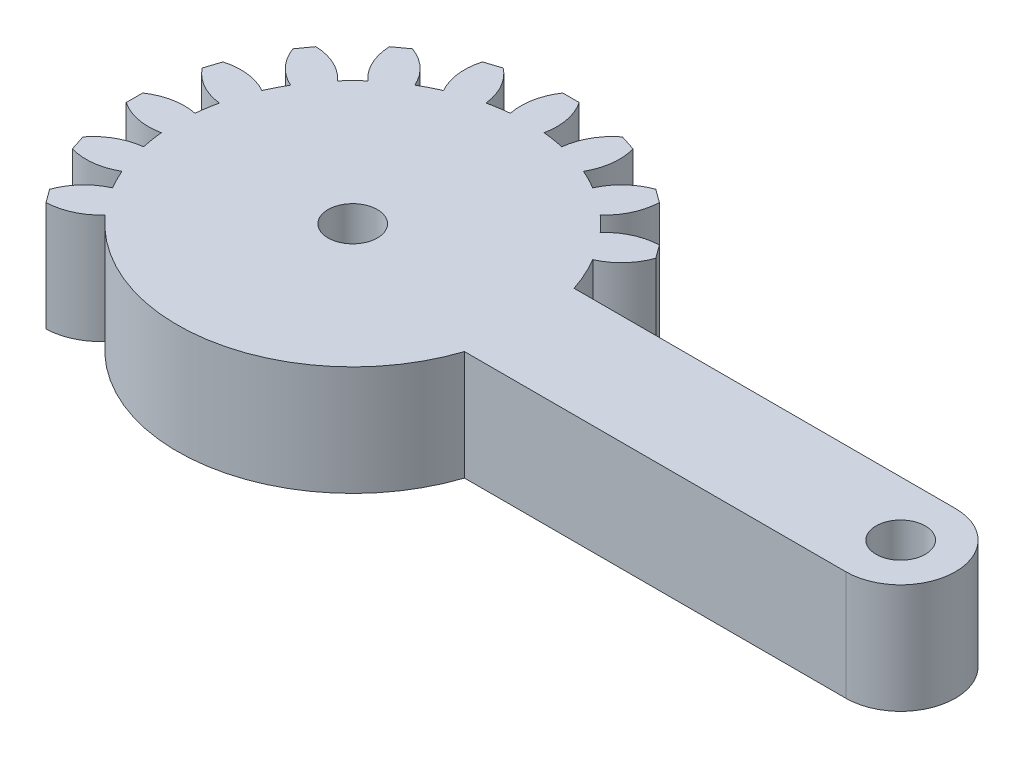
from build123d import *

# Parameters (mm, degrees)
SKETCH2_R           = 2.25
SKETCH2_R_2         = 16
BOSS_EXTRUDE1_DEPTH = 10


with BuildPart() as part:
    # Sketch2 → Boss-Extrude1 (new body)
    # profile 1 of 16: a face of its own
    with BuildSketch(Plane(origin=(0, 0, 0), x_dir=(1, 0, 0), z_dir=(0, 1, 0))):
        with BuildLine():
            ThreePointArc((50, -5), (55, 0), (50, 5))
            Line((50, 5), (18.789301737, 5))
            ThreePointArc((18.789301737, 5), (17.339527679, 3.953928118), (15.621614749, 3.459068176))
            ThreePointArc((15.621614749, 3.459068176), (15.80301345, 2.502951441), (15.925949353, 1.537575108))
            ThreePointArc((15.925949353, 1.537575108), (18.0017152, 1.549169767), (19.917509023, 0.75))
            Line((19.917509023, 0.75), (19.917509023, -0.75))
            ThreePointArc((19.917509023, -0.75), (18.0017152, -1.549169767), (15.925949353, -1.537575108))
            ThreePointArc((15.925949353, -1.537575108), (15.80301345, -2.502951441), (15.621614749, -3.459068176))
            ThreePointArc((15.621614749, -3.459068176), (17.339527679, -3.953928118), (18.789301737, -5))
            Line((18.789301737, -5), (50, -5))
        make_face()
        with Locations((50, 0)):
            Circle(SKETCH2_R, mode=Mode.SUBTRACT)
    # profile 2 of 16: a face of its own
    with BuildSketch(Plane(origin=(0, 0, 0), x_dir=(1, 0, 0), z_dir=(0, 1, 0))):
        with BuildLine():
            ThreePointArc((11.980599705, 10.604962551), (12.94427191, 9.404564037), (13.788127651, 8.117113766))
            ThreePointArc((13.788127651, 8.117113766), (15.474272667, 9.327838042), (16.554442225, 11.10045532))
            Line((16.554442225, 11.10045532), (15.672764346, 12.313980812))
            ThreePointArc((15.672764346, 12.313980812), (13.653114382, 11.834447379), (11.980599705, 10.604962551))
        make_face()
    # profile 3 of 16: a face of its own
    with BuildSketch(Plane(origin=(0, 0, 0), x_dir=(1, 0, 0), z_dir=(0, 1, 0))):
        with BuildLine():
            ThreePointArc((8.117113766, 13.788127651), (9.404564037, 12.94427191), (10.604962551, 11.980599705))
            ThreePointArc((10.604962551, 11.980599705), (11.834447379, 13.653114382), (12.313980812, 15.672764346))
            Line((12.313980812, 15.672764346), (11.10045532, 16.554442225))
            ThreePointArc((11.10045532, 16.554442225), (9.327838042, 15.474272667), (8.117113766, 13.788127651))
        make_face()
    # profile 4 of 16: a face of its own
    with BuildSketch(Plane(origin=(0, 0, 0), x_dir=(1, 0, 0), z_dir=(0, 1, 0))):
        with BuildLine():
            ThreePointArc((3.459068176, 15.621614749), (4.94427191, 15.216904261), (6.383709827, 14.671341072))
            ThreePointArc((6.383709827, 14.671341072), (7.036183926, 16.64192876), (6.868141161, 18.710913999))
            Line((6.868141161, 18.710913999), (5.441556387, 19.174439491))
            ThreePointArc((5.441556387, 19.174439491), (4.089487923, 17.599368331), (3.459068176, 15.621614749))
        make_face()
    # profile 5 of 16: a face of its own
    with BuildSketch(Plane(origin=(0, 0, 0), x_dir=(1, 0, 0), z_dir=(0, 1, 0))):
        with BuildLine():
            ThreePointArc((-1.537575108, 15.925949353), (0, 16), (1.537575108, 15.925949353))
            ThreePointArc((1.537575108, 15.925949353), (1.549169767, 18.0017152), (0.75, 19.917509023))
            Line((0.75, 19.917509023), (-0.75, 19.917509023))
            ThreePointArc((-0.75, 19.917509023), (-1.549169767, 18.0017152), (-1.537575108, 15.925949353))
        make_face()
    # profile 6 of 16: a face of its own
    with BuildSketch(Plane(origin=(0, 0, 0), x_dir=(1, 0, 0), z_dir=(0, 1, 0))):
        with BuildLine():
            ThreePointArc((-6.383709827, 14.671341072), (-4.94427191, 15.216904261), (-3.459068176, 15.621614749))
            ThreePointArc((-3.459068176, 15.621614749), (-4.089487923, 17.599368331), (-5.441556387, 19.174439491))
            Line((-5.441556387, 19.174439491), (-6.868141161, 18.710913999))
            ThreePointArc((-6.868141161, 18.710913999), (-7.036183926, 16.64192876), (-6.383709827, 14.671341072))
        make_face()
    # profile 7 of 16: a face of its own
    with BuildSketch(Plane(origin=(0, 0, 0), x_dir=(1, 0, 0), z_dir=(0, 1, 0))):
        with BuildLine():
            ThreePointArc((-10.604962551, 11.980599705), (-9.404564037, 12.94427191), (-8.117113766, 13.788127651))
            ThreePointArc((-8.117113766, 13.788127651), (-9.327838042, 15.474272667), (-11.10045532, 16.554442225))
            Line((-11.10045532, 16.554442225), (-12.313980812, 15.672764346))
            ThreePointArc((-12.313980812, 15.672764346), (-11.834447379, 13.653114382), (-10.604962551, 11.980599705))
        make_face()
    # profile 8 of 16: a face of its own
    with BuildSketch(Plane(origin=(0, 0, 0), x_dir=(1, 0, 0), z_dir=(0, 1, 0))):
        with BuildLine():
            ThreePointArc((-13.788127651, 8.117113766), (-12.94427191, 9.404564037), (-11.980599705, 10.604962551))
            ThreePointArc((-11.980599705, 10.604962551), (-13.653114382, 11.834447379), (-15.672764346, 12.313980812))
            Line((-15.672764346, 12.313980812), (-16.554442225, 11.10045532))
            ThreePointArc((-16.554442225, 11.10045532), (-15.474272667, 9.327838042), (-13.788127651, 8.117113766))
        make_face()
    # profile 9 of 16: a face of its own
    with BuildSketch(Plane(origin=(0, 0, 0), x_dir=(1, 0, 0), z_dir=(0, 1, 0))):
        with BuildLine():
            ThreePointArc((-15.621614749, 3.459068176), (-15.216904261, 4.94427191), (-14.671341072, 6.383709827))
            ThreePointArc((-14.671341072, 6.383709827), (-16.64192876, 7.036183926), (-18.710913999, 6.868141161))
            Line((-18.710913999, 6.868141161), (-19.174439491, 5.441556387))
            ThreePointArc((-19.174439491, 5.441556387), (-17.599368331, 4.089487923), (-15.621614749, 3.459068176))
        make_face()
    # profile 10 of 16: a face of its own
    with BuildSketch(Plane(origin=(0, 0, 0), x_dir=(1, 0, 0), z_dir=(0, 1, 0))):
        with BuildLine():
            ThreePointArc((-15.925949353, -1.537575108), (-16, 0), (-15.925949353, 1.537575108))
            ThreePointArc((-15.925949353, 1.537575108), (-18.0017152, 1.549169767), (-19.917509023, 0.75))
            Line((-19.917509023, 0.75), (-19.917509023, -0.75))
            ThreePointArc((-19.917509023, -0.75), (-18.0017152, -1.549169767), (-15.925949353, -1.537575108))
        make_face()
    # profile 11 of 16: a face of its own
    with BuildSketch(Plane(origin=(0, 0, 0), x_dir=(1, 0, 0), z_dir=(0, 1, 0))):
        with BuildLine():
            ThreePointArc((-18.710913999, -6.868141161), (-16.64192876, -7.036183926), (-14.671341072, -6.383709827))
            ThreePointArc((-14.671341072, -6.383709827), (-15.216904261, -4.94427191), (-15.621614749, -3.459068176))
            ThreePointArc((-15.621614749, -3.459068176), (-17.599368331, -4.089487923), (-19.174439491, -5.441556387))
            Line((-19.174439491, -5.441556387), (-18.710913999, -6.868141161))
        make_face()
    # profile 12 of 16: a face of its own
    with BuildSketch(Plane(origin=(0, 0, 0), x_dir=(1, 0, 0), z_dir=(0, 1, 0))):
        with BuildLine():
            ThreePointArc((-15.672764346, -12.313980812), (-13.653114382, -11.834447379), (-11.980599705, -10.604962551))
            ThreePointArc((-11.980599705, -10.604962551), (-12.94427191, -9.404564037), (-13.788127651, -8.117113766))
            ThreePointArc((-13.788127651, -8.117113766), (-15.474272667, -9.327838042), (-16.554442225, -11.10045532))
            Line((-16.554442225, -11.10045532), (-15.672764346, -12.313980812))
        make_face()
    # profile 13 of 16: a face of its own
    with BuildSketch(Plane(origin=(0, 0, 0), x_dir=(1, 0, 0), z_dir=(0, 1, 0))):
        with BuildLine():
            Line((15.198684154, -5), (18.789301737, -5))
            ThreePointArc((18.789301737, -5), (17.339527679, -3.953928118), (15.621614749, -3.459068176))
            ThreePointArc((15.621614749, -3.459068176), (15.429398038, -4.234817136), (15.198684154, -5))
        make_face()
    # profile 14 of 16: a face of its own
    with BuildSketch(Plane(origin=(0, 0, 0), x_dir=(1, 0, 0), z_dir=(0, 1, 0))):
        with BuildLine():
            ThreePointArc((19.917509023, 0.75), (18.0017152, 1.549169767), (15.925949353, 1.537575108))
            ThreePointArc((15.925949353, 1.537575108), (15.981476616, 0.76967862), (16, 0))
            ThreePointArc((16, 0), (15.981476616, -0.76967862), (15.925949353, -1.537575108))
            ThreePointArc((15.925949353, -1.537575108), (18.0017152, -1.549169767), (19.917509023, -0.75))
            Line((19.917509023, -0.75), (19.917509023, 0.75))
        make_face()
    # profile 15 of 16: a face of its own
    with BuildSketch(Plane(origin=(0, 0, 0), x_dir=(1, 0, 0), z_dir=(0, 1, 0))):
        with BuildLine():
            ThreePointArc((15.621614749, 3.459068176), (17.339527679, 3.953928118), (18.789301737, 5))
            Line((18.789301737, 5), (15.198684154, 5))
            ThreePointArc((15.198684154, 5), (15.429398038, 4.234817136), (15.621614749, 3.459068176))
        make_face()
    # profile 16 of 16: a face of its own
    with BuildSketch(Plane(origin=(0, 0, 0), x_dir=(1, 0, 0), z_dir=(0, 1, 0))):
        Circle(SKETCH2_R_2)
        Circle(SKETCH2_R, mode=Mode.SUBTRACT)
    extrude(amount=BOSS_EXTRUDE1_DEPTH)


solid = part.part
